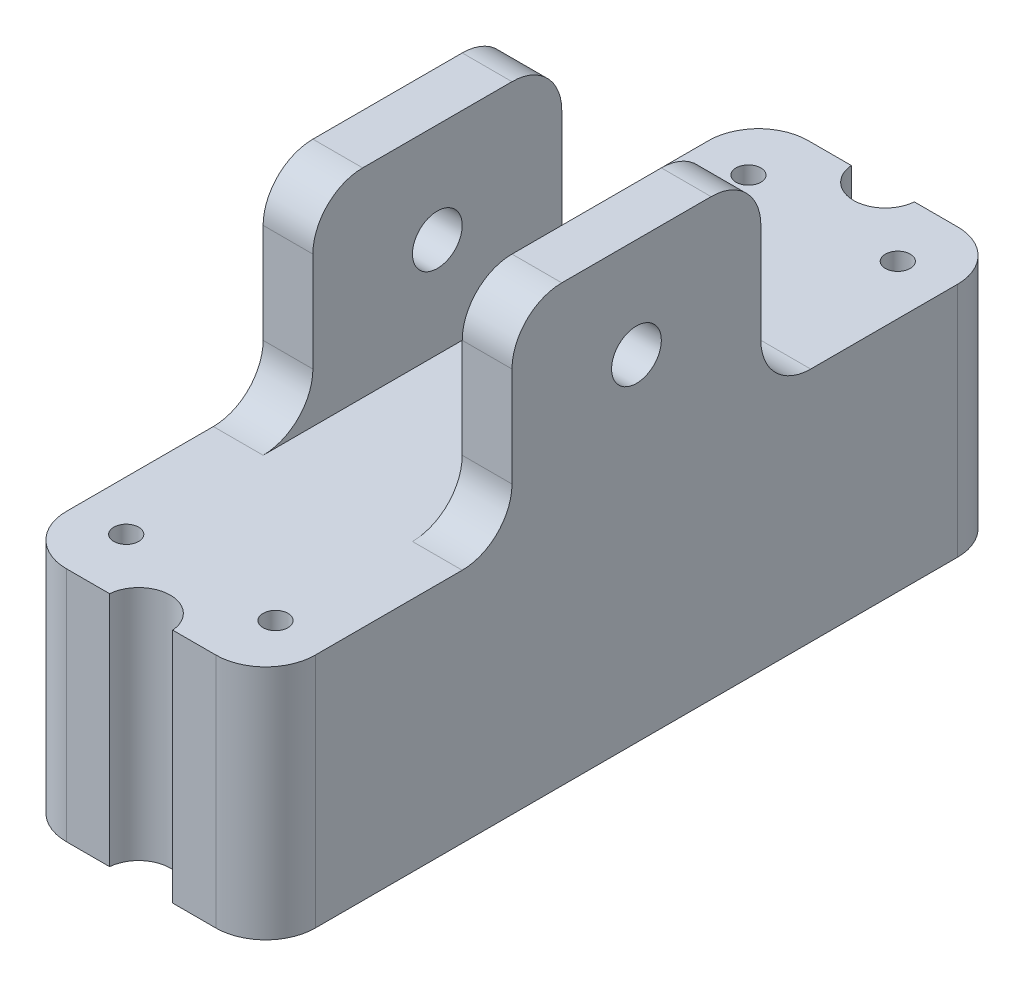
from build123d import *

# Parameters (mm, degrees)
BOSS_EXTRUDE1_DEPTH      = 10
BOSS_EXTRUDE1_DEPTH_BACK = 37.5
SKETCH1_R                = 2.5
SKETCH2_W                = 10
SKETCH2_H                = 50
BOSS_EXTRUDE2_DEPTH      = 50
SKETCH4_R                = 5
CUT_EXTRUDE2_DEPTH       = 103.714409895
FILLET1_R                = 10


with BuildPart() as part:
    # Sketch1 → Boss-Extrude1 (new, two sides: drawn at the far end of the back side and taken through both)
    with BuildSketch(Plane(origin=(0, 0, 0), x_dir=(1, 0, 0), z_dir=(0, 1, 0)).offset(-BOSS_EXTRUDE1_DEPTH_BACK)):
        with BuildLine():
            Line((-25, 74.5), (-25, -74.5))
            Line((-25, -74.5), (-6.330284354, -74.5))
            ThreePointArc((-6.330284354, -74.5), (0, -68.65), (6.330284354, -74.5))
            Line((6.330284354, -74.5), (25, -74.5))
            Line((25, -74.5), (25, -17))
            Line((25, -17), (25, 17))
            Line((25, 17), (25, 74.5))
            Line((25, 74.5), (6.330284354, 74.5))
            ThreePointArc((6.330284354, 74.5), (0, 68.65), (-6.330284354, 74.5))
            Line((-6.330284354, 74.5), (-25, 74.5))
        make_face()
        with Locations((-15, -62.5)):
            Circle(SKETCH1_R, mode=Mode.SUBTRACT)
        with Locations((15, -62.5)):
            Circle(SKETCH1_R, mode=Mode.SUBTRACT)
        with Locations((-15, 62.5)):
            Circle(SKETCH1_R, mode=Mode.SUBTRACT)
        with Locations((15, 62.5)):
            Circle(SKETCH1_R, mode=Mode.SUBTRACT)
    extrude(amount=BOSS_EXTRUDE1_DEPTH + BOSS_EXTRUDE1_DEPTH_BACK)

    # Sketch2 → Boss-Extrude2 (add)
    with BuildSketch(Plane(origin=(0, 0, 0), x_dir=(1, 0, 0), z_dir=(0, 1, 0))):
        with Locations((20, 0)):
            Rectangle(SKETCH2_W, SKETCH2_H)
        with Locations((-20, 0)):
            Rectangle(SKETCH2_W, SKETCH2_H)
    extrude(amount=BOSS_EXTRUDE2_DEPTH)

    # Sketch4 → Cut-Extrude2 (cut, through all)
    with BuildSketch(Plane(origin=(25, 0, 0), x_dir=(0, 0, -1), z_dir=(1, 0, 0))):
        with Locations((0, 30)):
            Circle(SKETCH4_R)
    extrude(amount=-CUT_EXTRUDE2_DEPTH, mode=Mode.SUBTRACT)

    # Fillet1
    fillet1_edges = [part.edges().sort_by_distance(p)[0] for p in [
        (-20, 50, -25),
        (-20, 50, 25),
        (-20, 10, 25),
        (-20, 10, -25),
        (20, 50, -25),
        (20, 50, 25),
        (20, 10, 25),
        (20, 10, -25),
        (25, -13.75, -74.5),
        (-25, -13.75, -74.5),
        (-25, -13.75, 74.5),
        (25, -13.75, 74.5),
    ]]
    fillet(fillet1_edges, radius=FILLET1_R)


solid = part.part
